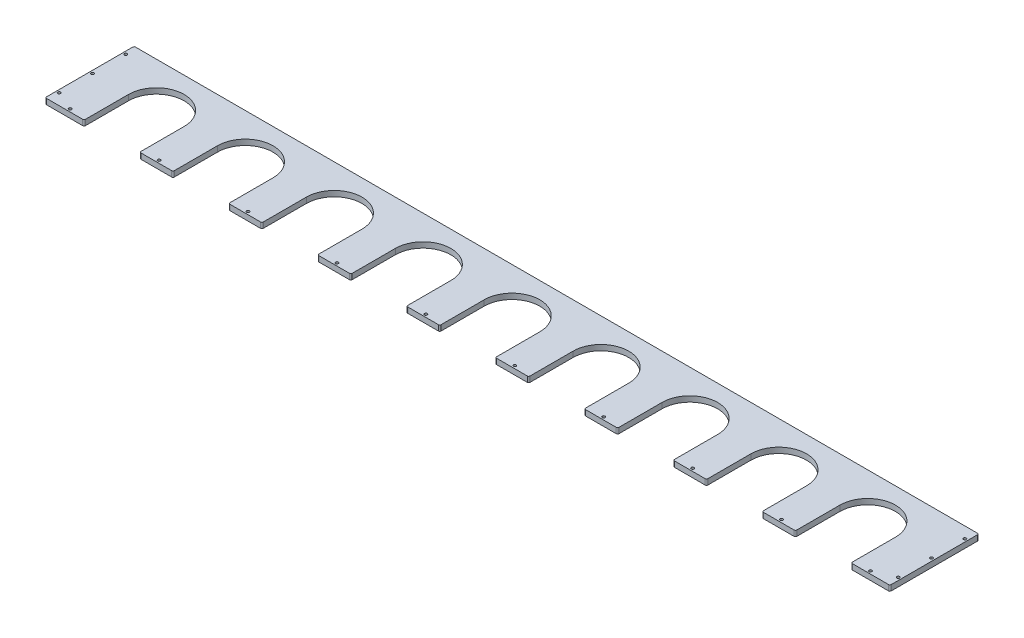
from build123d import *

# Parameters (mm, degrees)
SKETCH1_W                   = 1930.4
SKETCH1_H                   = 203.2
BOSS_EXTRUDE1_DEPTH         = 12.7
CUT_EXTRUDE1_DEPTH          = 971.615727258
FILLET1_R                   = 3.175
F_1_4_0_25_DIAMETER_HOLE1_D = 6.35


with BuildPart() as part:
    # Sketch1 → Boss-Extrude1 (new body)
    with BuildSketch(Plane(origin=(0, 0, 0), x_dir=(1, 0, 0), z_dir=(0, 1, 0))):
        Rectangle(SKETCH1_W, SKETCH1_H)
    extrude(amount=BOSS_EXTRUDE1_DEPTH)

    # Sketch2 → Cut-Extrude1 (cut, through all)
    with BuildSketch(Plane(origin=(0, 12.7, 0), x_dir=(1, 0, 0), z_dir=(0, 1, 0))):
        with BuildLine():
            Line((-876.3, 0), (-876.3, -101.6))
            Line((-876.3, -101.6), (-749.3, -101.6))
            Line((-749.3, -101.6), (-749.3, 0))
            ThreePointArc((-749.3, 0), (-812.8, 63.5), (-876.3, 0))
        make_face()
        with BuildLine():
            Line((-673.1, 0), (-673.1, -101.6))
            Line((-673.1, -101.6), (-546.1, -101.6))
            Line((-546.1, -101.6), (-546.1, 0))
            ThreePointArc((-546.1, 0), (-609.6, 63.5), (-673.1, 0))
        make_face()
        with BuildLine():
            Line((-469.9, 0), (-469.9, -101.6))
            Line((-469.9, -101.6), (-342.9, -101.6))
            Line((-342.9, -101.6), (-342.9, 0))
            ThreePointArc((-342.9, 0), (-406.4, 63.5), (-469.9, 0))
        make_face()
        with BuildLine():
            Line((-266.7, 0), (-266.7, -101.6))
            Line((-266.7, -101.6), (-139.7, -101.6))
            Line((-139.7, -101.6), (-139.7, 0))
            ThreePointArc((-139.7, 0), (-203.2, 63.5), (-266.7, 0))
        make_face()
        with BuildLine():
            Line((-63.5, 0), (-63.5, -101.6))
            Line((-63.5, -101.6), (63.5, -101.6))
            Line((63.5, -101.6), (63.5, 0))
            ThreePointArc((63.5, 0), (0, 63.5), (-63.5, 0))
        make_face()
        with BuildLine():
            Line((139.7, 0), (139.7, -101.6))
            Line((139.7, -101.6), (266.7, -101.6))
            Line((266.7, -101.6), (266.7, 0))
            ThreePointArc((266.7, 0), (203.2, 63.5), (139.7, 0))
        make_face()
        with BuildLine():
            Line((342.9, 0), (342.9, -101.6))
            Line((342.9, -101.6), (469.9, -101.6))
            Line((469.9, -101.6), (469.9, 0))
            ThreePointArc((469.9, 0), (406.4, 63.5), (342.9, 0))
        make_face()
        with BuildLine():
            Line((546.1, 0), (546.1, -101.6))
            Line((546.1, -101.6), (673.1, -101.6))
            Line((673.1, -101.6), (673.1, 0))
            ThreePointArc((673.1, 0), (609.6, 63.5), (546.1, 0))
        make_face()
        with BuildLine():
            Line((749.3, 0), (749.3, -101.6))
            Line((749.3, -101.6), (876.3, -101.6))
            Line((876.3, -101.6), (876.3, 0))
            ThreePointArc((876.3, 0), (812.8, 63.5), (749.3, 0))
        make_face()
    extrude(amount=-CUT_EXTRUDE1_DEPTH, mode=Mode.SUBTRACT)

    # Fillet1
    fillet1_edges = [part.edges().sort_by_distance(p)[0] for p in [
        (965.2, 6.35, -101.6),
        (965.2, 6.35, 101.6),
        (876.3, 6.35, 101.6),
        (749.3, 6.35, 101.6),
        (673.1, 6.35, 101.6),
        (546.1, 6.35, 101.6),
        (469.9, 6.35, 101.6),
        (342.9, 6.35, 101.6),
        (266.7, 6.35, 101.6),
        (139.7, 6.35, 101.6),
        (63.5, 6.35, 101.6),
        (-63.5, 6.35, 101.6),
        (-139.7, 6.35, 101.6),
        (-266.7, 6.35, 101.6),
        (-342.9, 6.35, 101.6),
        (-469.9, 6.35, 101.6),
        (-546.1, 6.35, 101.6),
        (-749.3, 6.35, 101.6),
        (-673.1, 6.35, 101.6),
        (-876.3, 6.35, 101.6),
        (-965.2, 6.35, 101.6),
        (-965.2, 6.35, -101.6),
    ]]
    fillet(fillet1_edges, radius=FILLET1_R)

    # 1/4 (0.25) Diameter Hole1 (through all)
    with Locations(Plane(origin=(0, 12.7, 0), x_dir=(1, 0, 0), z_dir=(0, 1, 0))):
        with Locations((-958.85, 76.2), (-958.85, 0), (-958.85, -76.2), (958.85, -76.2), (958.85, 0), (958.85, 76.2), (-914.4, -95.25), (-711.2, -95.25), (-508, -95.25), (-304.8, -95.25), (-101.6, -95.25), (101.6, -95.25), (304.8, -95.25), (508, -95.25), (711.2, -95.25), (914.4, -95.25)):
            Hole(F_1_4_0_25_DIAMETER_HOLE1_D / 2)


solid = part.part
